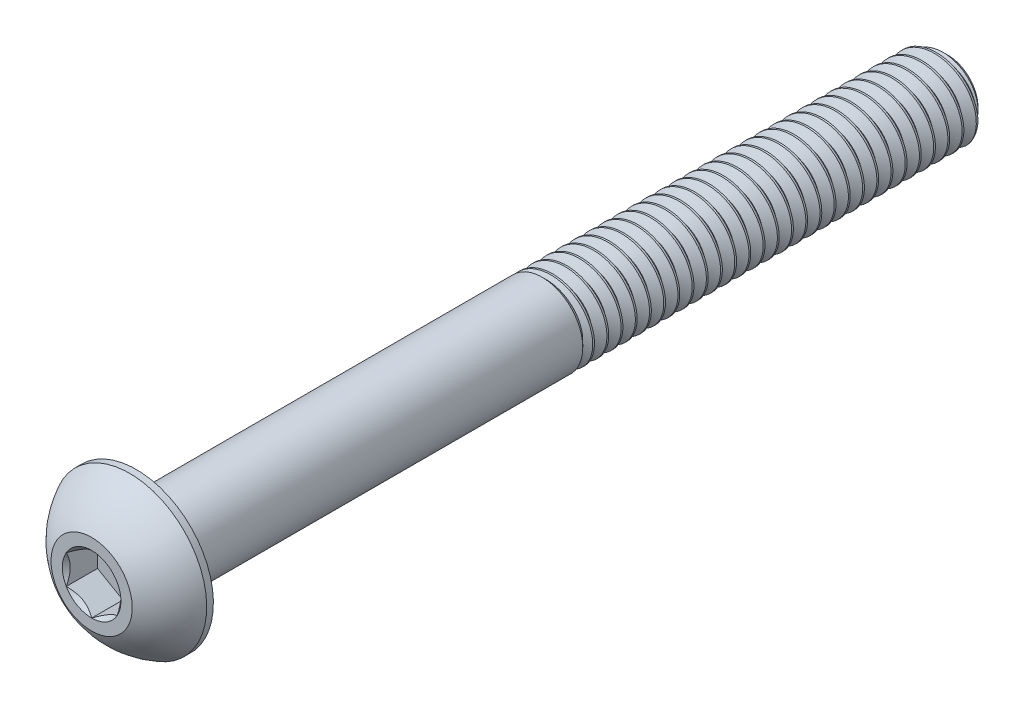
from build123d import *

# Parameters (mm, degrees)
CUT_EXTRUDE2_DEPTH = 1.54
CUT_SWEEP2_PITCH   = 0.7
CUT_SWEEP2_TO      = 20


with BuildPart() as part:
    # Sketch10 → Revolve3 (revolve)
    with BuildSketch(Plane(origin=(0, 0, 0), x_dir=(0, 0, -1), z_dir=(1, 0, 0)), mode=Mode.PRIVATE) as revolve3_sk:
        Polygon((19.475, 2), (20, 1.475), (20, 0), (-20, 0), (-20, 2), align=None)
    revolve(revolve3_sk.sketch.rotate(Axis((0, 0, 22.2), (0, 0, -1)), 180), axis=Axis((0, 0, 22.2), (0, 0, -1)))

    # Sketch7 → Revolve2 (revolve)
    with BuildSketch(Plane(origin=(0, 0, 0), x_dir=(0, 0, -1), z_dir=(1, 0, 0)), mode=Mode.PRIVATE) as revolve2_sk:
        with BuildLine():
            Line((-20.33, 3.8), (-20, 3.8))
            Line((-20, 3.8), (-20, 0))
            Line((-20, 0), (-22.2, 0))
            Line((-22.2, 0), (-22.2, 2))
            ThreePointArc((-22.2, 2), (-21.406499853, 3.047002626), (-20.33, 3.8))
        make_face()
    revolve(revolve2_sk.sketch.rotate(Axis((0, 0, 22.2), (0, 0, -1)), 180), axis=Axis((0, 0, 22.2), (0, 0, -1)))

    # Sketch5 → Cut-Extrude2 (cut)
    with BuildSketch(Plane.XY.offset(22.2)):
        Polygon((1.25, -0.721687836), (1.25, 0.721687836), (0, 1.443375673), (-1.25, 0.721687836), (-1.25, -0.721687836), (0, -1.443375673), align=None)
    extrude(amount=-CUT_EXTRUDE2_DEPTH, mode=Mode.SUBTRACT)

    # Cut-Extrude3 cone 1 section (through the dimple's axis) → Cut-Extrude3 (revolve, cut)
    with BuildSketch(Plane(origin=(0, 0, 22.2), x_dir=(0, -1, 0), z_dir=(1, 0, 0))):
        Polygon((0, 0), (1.443375673, 0), (0, 1.443375673), align=None)
    revolve(axis=Axis((0, 0, 22.2), (0, 0, -1)), mode=Mode.SUBTRACT)


with BuildPart() as body_2:
    # Split1: the piece on the far side of the plane
    add(part.part)
    split(bisect_by=Plane.XY, keep=Keep.BOTTOM)

    # Cut-Sweep2: arcs per turn and ends read off the stored shape
    # Cut-Sweep2: the profile of Sketch12 screwed along a right-hand helix through 31.714286 turns, 6 arcs to a turn; built about Z, then put on its axis
    cut_sweep2_z = Axis((0, 0, 0), (0, 0, 1))
    cut_sweep2_corners = [(1.545336663, 0, -0.2625), (1.545336663, 0, -0.35), (2.037888611, 0, -0.634375), (2.037888611, 0, 0.021875)]
    with BuildLine(mode=Mode.PRIVATE) as cut_sweep2_profile:
        Line(cut_sweep2_corners[0], cut_sweep2_corners[1])
        Line(cut_sweep2_corners[1], cut_sweep2_corners[2])
        Line(cut_sweep2_corners[2], cut_sweep2_corners[3])
        Line(cut_sweep2_corners[3], cut_sweep2_corners[0])
    cut_sweep2_cap = Face(cut_sweep2_profile.wire())
    cut_sweep2_turn_angles = [0, 30, 60, 90, 120, 150, 180, 210, 240, 270, 300, 330, 360]
    cut_sweep2_turn_weights = [1, 0.8660254037844387, 1, 0.8660254037844387, 1, 0.8660254037844387, 1, 0.8660254037844387, 1, 0.8660254037844387, 1, 0.8660254037844387, 1]
    cut_sweep2_turn_rails = [Edge.make_bspline([Vector(p[0], p[1], 0).rotate(cut_sweep2_z, cut_sweep2_turn_angles[k]) / cut_sweep2_turn_weights[k] + Vector(0, 0, p[2] + CUT_SWEEP2_PITCH * cut_sweep2_turn_angles[k] / 360) for k in range(13)], [0, 0, 0, 1, 1, 2, 2, 3, 3, 4, 4, 5, 5, 6, 6, 6], 2, cut_sweep2_turn_weights) for p in cut_sweep2_corners]
    cut_sweep2_turn_sides = [Face.make_surface_from_curves(cut_sweep2_turn_rails[p[0]], cut_sweep2_turn_rails[p[1]]) for p in [(0, 1), (1, 2), (2, 3), (3, 0)]]
    cut_sweep2_last_angles = [11160, 11190, 11220, 11250, 11280, 11310, 11340, 11370, 11400, 11408.571428571, 11417.142857143]
    cut_sweep2_last_weights = [1, 0.8660254037844387, 1, 0.8660254037844387, 1, 0.8660254037844387, 1, 0.8660254037844387, 1, 0.988830826225091, 1]
    cut_sweep2_last_rails = [Edge.make_bspline([Vector(p[0], p[1], 0).rotate(cut_sweep2_z, cut_sweep2_last_angles[k]) / cut_sweep2_last_weights[k] + Vector(0, 0, p[2] + CUT_SWEEP2_PITCH * cut_sweep2_last_angles[k] / 360) for k in range(11)], [0, 0, 0, 1, 1, 2, 2, 3, 3, 4, 4, 5, 5, 5], 2, cut_sweep2_last_weights) for p in cut_sweep2_corners]
    cut_sweep2_last_sides = [Face.make_surface_from_curves(cut_sweep2_last_rails[p[0]], cut_sweep2_last_rails[p[1]]) for p in [(0, 1), (1, 2), (2, 3), (3, 0)]]
    cut_sweep2 = Plane(origin=(0, 0, -20), x_dir=(0, 1, 0), z_dir=(0, 0, 1)) * split(Solid(Shell([*[p.moved(Location((0, 0, CUT_SWEEP2_PITCH * i))) for i in range(31) for p in cut_sweep2_turn_sides], *cut_sweep2_last_sides, cut_sweep2_cap, cut_sweep2_cap.rotate(cut_sweep2_z, 11417.142857143).moved(Location((0, 0, CUT_SWEEP2_PITCH * 11417.142857143 / 360)))])), bisect_by=Plane.XY.offset(CUT_SWEEP2_TO), keep=Keep.BOTTOM, mode=Mode.PRIVATE)
    add(cut_sweep2, mode=Mode.SUBTRACT)


with BuildPart() as part_1:
    add(part.part)

    # Split1
    split(bisect_by=Plane.XY, keep=Keep.TOP)

    add(body_2.part)  # Boss-Extrude1 merges body 2
    # Boss-Extrude1 cone 1 section (through the dimple's axis) → Boss-Extrude1 (revolve)
    with BuildSketch(Plane(origin=(0, 0, 0), x_dir=(0, -1, 0), z_dir=(1, 0, 0))):
        Polygon((0, 0), (2, 0), (0, 2), align=None)
    revolve(axis=Axis((0, 0, 0), (0, 0, -1)))


solid = part_1.part
